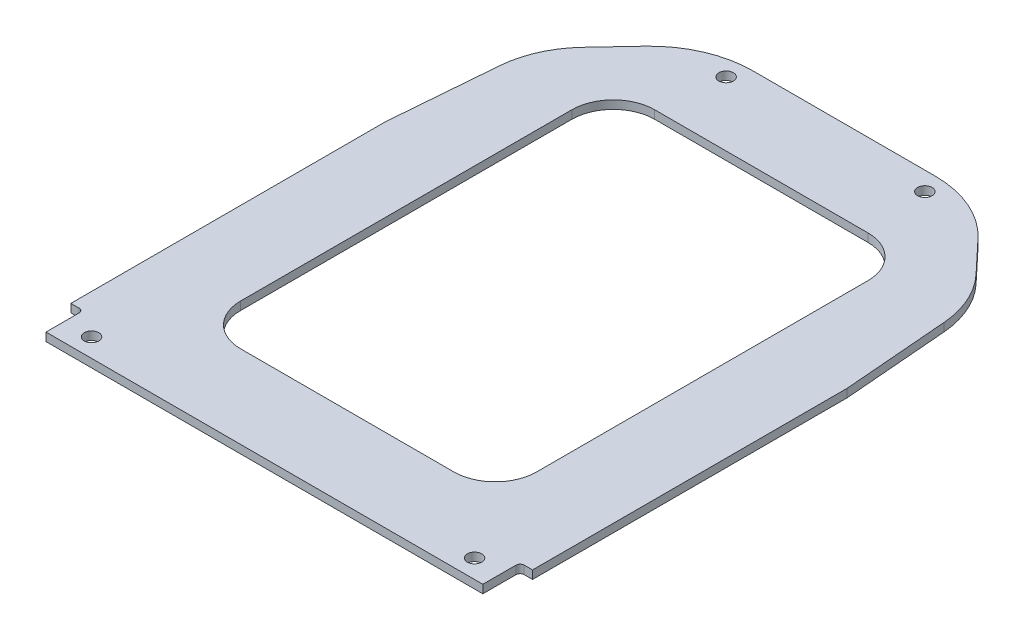
from build123d import *

# Parameters (mm, degrees)
ESQUISSE1_R        = 1.75
ESQUISSE1_W        = 71.5
ESQUISSE1_H        = 100
BOSS_EXTRU_1_DEPTH = 2
FILLET1_R          = 10


with BuildPart() as part:
    # Esquisse1 → Boss.-Extru.1 (new body)
    with BuildSketch(Plane(origin=(0, 0, 0), x_dir=(1, 0, 0), z_dir=(0, 1, 0))):
        with BuildLine():
            Line((-52.75, -62), (-52.75, -70))
            Line((-52.75, -70), (52.75, -70))
            Line((52.75, -70), (52.75, -62))
            ThreePointArc((52.75, -62), (53.042893219, -61.292893219), (53.75, -61))
            Line((53.75, -61), (55.75, -61))
            Line((55.75, -61), (55.75, 15))
            Line((55.75, 15), (53.674026321, 40.47775659))
            ThreePointArc((53.674026321, 40.47775659), (51.771291303, 47.94288813), (47.510174455, 54.360946457))
            Line((47.510174455, 54.360946457), (40.217580929, 62.120740202))
            ThreePointArc((40.217580929, 62.120740202), (31.924250474, 67.945789429), (22, 70))
            Line((22, 70), (-22, 70))
            ThreePointArc((-22, 70), (-31.924250474, 67.945789429), (-40.217580929, 62.120740202))
            Line((-40.217580929, 62.120740202), (-47.510174455, 54.360946457))
            ThreePointArc((-47.510174455, 54.360946457), (-51.771291303, 47.94288813), (-53.674026321, 40.47775659))
            Line((-53.674026321, 40.47775659), (-55.75, 15))
            Line((-55.75, 15), (-55.75, -61))
            Line((-55.75, -61), (-53.75, -61))
            ThreePointArc((-53.75, -61), (-53.042893219, -61.292893219), (-52.75, -62))
        make_face()
        with Locations((-46.25, -65.5)):
            Circle(ESQUISSE1_R, mode=Mode.SUBTRACT)
        with Locations((46.25, -65.5)):
            Circle(ESQUISSE1_R, mode=Mode.SUBTRACT)
        Rectangle(ESQUISSE1_W, ESQUISSE1_H, mode=Mode.SUBTRACT)
        with Locations((-24, 65.5)):
            Circle(ESQUISSE1_R, mode=Mode.SUBTRACT)
        with Locations((24, 65.5)):
            Circle(ESQUISSE1_R, mode=Mode.SUBTRACT)
    extrude(amount=BOSS_EXTRU_1_DEPTH)

    # Fillet1
    fillet1_edges = [part.edges().sort_by_distance(p)[0] for p in [
        (35.75, 1, 50),
        (-35.75, 1, 50),
        (35.75, 1, -50),
        (-35.75, 1, -50),
    ]]
    fillet(fillet1_edges, radius=FILLET1_R)


solid = part.part
